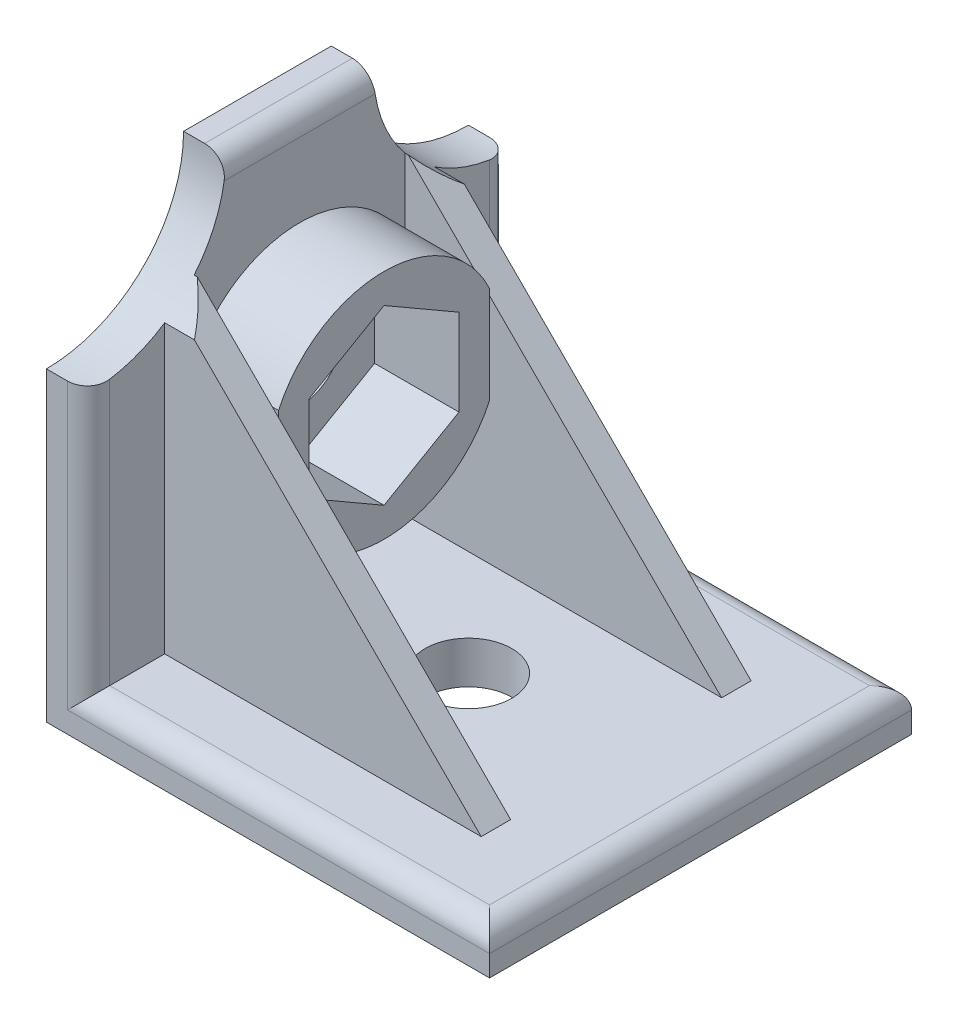
from build123d import *

# Parameters (mm, degrees)
ESQUISSE1_W                  = 21
ESQUISSE1_H                  = 20
BOSS_EXTRU_1_DEPTH           = 2
ESQUISSE2_W                  = 2
ESQUISSE2_H                  = 20
BOSS_EXTRU_2_DEPTH           = 19
ESQUISSE3_R                  = 2.05
ENL_V_MAT_EXTRU_1_DEPTH      = 20
ESQUISSE4_R                  = 2.05
ENL_V_MAT_EXTRU_2_DEPTH      = 20
ESQUISSE5_W                  = 15
ESQUISSE5_H                  = 1.39480656
BOSS_EXTRU_3_DEPTH           = 15
CHANFREIN1_SIZE              = 15
CONG_1_R                     = 1
BOSS_EXTRU_12_DEPTH          = 4
ENL_V_MAT_EXTRU_3_DEPTH      = 26.51960031
ENL_V_MAT_EXTRU_3_DEPTH_BACK = 26.51960031
ESQUISSE9_R                  = 6.5


with BuildPart() as part:
    # Esquisse1 → Boss.-Extru.1 (new body)
    with BuildSketch(Plane(origin=(0, 0, 0), x_dir=(1, 0, 0), z_dir=(0, 1, 0))):
        Rectangle(ESQUISSE1_W, ESQUISSE1_H)
    extrude(amount=BOSS_EXTRU_1_DEPTH)

    # Esquisse2 → Boss.-Extru.2 (add)
    with BuildSketch(Plane(origin=(0, 2, 0), x_dir=(1, 0, 0), z_dir=(0, 1, 0))):
        with Locations((-9.5, 0)):
            Rectangle(ESQUISSE2_W, ESQUISSE2_H)
    extrude(amount=BOSS_EXTRU_2_DEPTH)

    # Esquisse3 → Enlèv. mat.-Extru.1 (cut)
    with BuildSketch(Plane(origin=(0, 2, 0), x_dir=(1, 0, 0), z_dir=(0, 1, 0))):
        with Locations(Location((-0.5, 0, 0), (0, 0, 270))):
            Circle(ESQUISSE3_R)
    extrude(amount=-ENL_V_MAT_EXTRU_1_DEPTH, mode=Mode.SUBTRACT)

    # Esquisse4 → Enlèv. mat.-Extru.2 (cut)
    with BuildSketch(Plane(origin=(-8.5, 0, 0), x_dir=(0, 0, -1), z_dir=(1, 0, 0))):
        with Locations((0, 11)):
            Circle(ESQUISSE4_R)
    extrude(amount=-ENL_V_MAT_EXTRU_2_DEPTH, mode=Mode.SUBTRACT)

    # Esquisse5 → Boss.-Extru.3 (add)
    with BuildSketch(Plane(origin=(0, 2, 0), x_dir=(1, 0, 0), z_dir=(0, 1, 0))):
        with Locations((-1, -5.69740328)):
            Rectangle(ESQUISSE5_W, ESQUISSE5_H)
        with Locations((-1, 5.69740328)):
            Rectangle(ESQUISSE5_W, ESQUISSE5_H)
    extrude(amount=BOSS_EXTRU_3_DEPTH)

    # Chanfrein1
    chanfrein1_edges = [part.edges().sort_by_distance(p)[0] for p in [
        (6.5, 17, 5.69740328),
        (6.5, 17, -5.69740328),
    ]]
    chamfer(chanfrein1_edges, length=CHANFREIN1_SIZE - 0.0001)  # a hair under: the kernel refuses the full size

    # Congé1
    cong_1_edges = [part.edges().sort_by_distance(p)[0] for p in [
        (10.5, 2, 0),
        (1, 2, 10),
        (-8.5, 21, 0),
        (-8.5, 11.5, 10),
        (-8.5, 11.5, -10),
        (1, 2, -10),
    ]]
    fillet(cong_1_edges, radius=CONG_1_R)

    # Esquisse7 → Boss.-Extru.12 (add)
    with BuildSketch(Plane(origin=(-8.5, 0, 0), x_dir=(0, 0, -1), z_dir=(1, 0, 0))):
        with BuildLine():
            Line((5, 8.708712153), (5, 13.291287847))
            ThreePointArc((5, 13.291287847), (0, 16.5), (-5, 13.291287847))
            Line((-5, 13.291287847), (-5, 8.708712153))
            ThreePointArc((-5, 8.708712153), (0, 5.5), (5, 8.708712153))
        make_face()
        Polygon((3.55, 8.950406544), (0, 6.900813089), (-3.55, 8.950406544), (-3.55, 13.049593456), (0, 15.099186911), (3.55, 13.049593456), align=None, mode=Mode.SUBTRACT)
    extrude(amount=BOSS_EXTRU_12_DEPTH)

    # Esquisse9 → Enlèv. mat.-Extru.3 (cut, two sides: drawn at the far end of the back side and taken through both)
    with BuildSketch(Plane(origin=(0, 0, 0), x_dir=(0, 0, -1), z_dir=(1, 0, 0)).offset(-ENL_V_MAT_EXTRU_3_DEPTH_BACK)):
        with Locations((-10, 21)):
            Circle(ESQUISSE9_R)
        with Locations((10, 21)):
            Circle(ESQUISSE9_R)
    extrude(amount=ENL_V_MAT_EXTRU_3_DEPTH + ENL_V_MAT_EXTRU_3_DEPTH_BACK, mode=Mode.SUBTRACT)


solid = part.part
